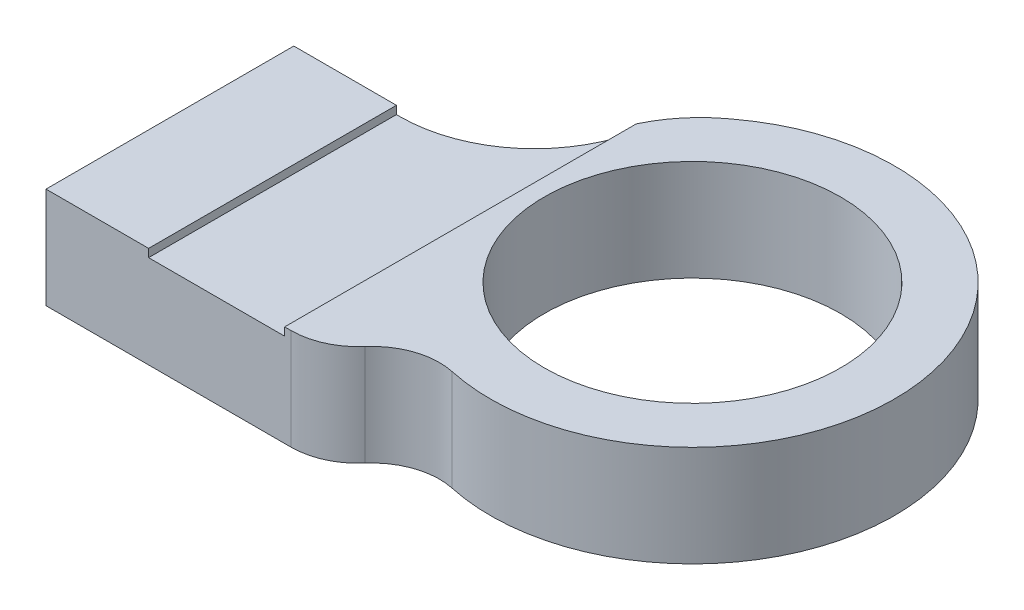
from build123d import *
from build123d.topology import SkipClean

# Parameters (mm, degrees)
BOSS_EXTRUDE1_DEPTH = 2.5
SKETCH2_W           = 10
SKETCH2_H           = 20
CUT_EXTRUDE1_DEPTH  = 0.6
SKETCH4_R           = 11
CUT_EXTRUDE2_DEPTH  = 34.634060118
BOSS_EXTRUDE2_START = 5
SKETCH6_R           = 15
BOSS_EXTRUDE2_DEPTH = 5
SKETCH7_R           = 11
CUT_EXTRUDE3_DEPTH  = 34.911649916
SKETCH8_W           = 18.819660113
SKETCH8_H           = 20
BOSS_EXTRUDE3_DEPTH = 5
FILLET1_R           = 10
BOSS_EXTRUDE4_DEPTH = 8
SKETCH11_W          = 16.12
SKETCH11_H          = 10
CUT_EXTRUDE6_DEPTH  = 10
FILLET2_R           = 10
FILLET3_R           = 10
FILLET4_R           = 5
FILLET5_R           = 5
SKETCH12_W          = 1.6
SKETCH12_H          = 32.071627579
CUT_EXTRUDE7_DEPTH  = 0.6
SKETCH13_W          = 1.5
SKETCH13_H          = 20
BOSS_EXTRUDE5_DEPTH = 0.6
SKETCH14_W          = 17.743382102
SKETCH14_H          = 16.653616468
CUT_EXTRUDE8_DEPTH  = 36.780581326
FILLET6_R           = 10
FILLET7_R           = 10


with BuildPart() as part:
    # Sketch1 → Boss-Extrude1 (new body)
    with BuildSketch(Plane(origin=(0, 0, 0), x_dir=(1, 0, 0), z_dir=(0, 1, 0))):
        with BuildLine():
            Line((-30, -10), (-11.180339887, -10))
            ThreePointArc((-11.180339887, -10), (15, 0), (-11.180339887, 10))
            Line((-11.180339887, 10), (-30, 10))
            Line((-30, 10), (-30, -10))
        make_face()
    extrude(amount=BOSS_EXTRUDE1_DEPTH)

    # Sketch2 → Cut-Extrude1 (cut)
    with BuildSketch(Plane(origin=(0, 2.5, 0), x_dir=(1, 0, 0), z_dir=(0, 1, 0))):
        with Locations((-18.880339887, 0)):
            Rectangle(SKETCH2_W, SKETCH2_H)
    extrude(amount=-CUT_EXTRUDE1_DEPTH, mode=Mode.SUBTRACT)

    # Sketch4 → Cut-Extrude2 (cut, through all)
    with BuildSketch(Plane(origin=(0, 2.5, 0), x_dir=(1, 0, 0), z_dir=(0, 1, 0))):
        with Locations(Location((0, 0, 0), (0, 0, 270))):
            Circle(SKETCH4_R)
    extrude(amount=-CUT_EXTRUDE2_DEPTH, mode=Mode.SUBTRACT)

    # Sketch6 → Boss-Extrude2 (add)
    with SkipClean():  # the faces are left unmerged after this step: merging them gives an invalid solid
        with BuildSketch(Plane.XZ.offset(BOSS_EXTRUDE2_START)):
            with Locations(Location((0, 0, 0), (0, 0, 270))):
                Circle(SKETCH6_R)
        extrude(amount=-BOSS_EXTRUDE2_DEPTH)

    # Sketch7 → Cut-Extrude3 (cut, through all)
    with SkipClean():  # the faces are left unmerged after this step: merging them gives an invalid solid
        with BuildSketch(Plane(origin=(0, 0, 0), x_dir=(1, 0, 0), z_dir=(0, 1, 0))):
            with Locations(Location((0, 0, 0), (0, 0, 270))):
                Circle(SKETCH7_R)
        extrude(amount=-CUT_EXTRUDE3_DEPTH, mode=Mode.SUBTRACT)

    # Sketch8 → Boss-Extrude3 (add)
    with SkipClean():  # the faces are left unmerged after this step: merging them gives an invalid solid
        with BuildSketch(Plane.XZ):
            with Locations((-20.590169944, 0)):
                Rectangle(SKETCH8_W, SKETCH8_H)
        extrude(amount=BOSS_EXTRUDE3_DEPTH)

    # Fillet1
    # the kernel refuses this fillet: 10 mm, written as the material it adds along each edge
    with BuildSketch(Plane(origin=(-11.180339887, 0, -10), x_dir=(-1, 0, 0), z_dir=(0, -1, 0))) as fillet1_piece_1:
        with BuildLine():
            CenterArc((3.819660113, 10), FILLET1_R, 233.130102354, 36.869897646)
            ThreePointArc((-2.180339887, 2), (-1.040737849, 1.053889384), (0, 0))
            Line((0, 0), (3.819660113, 0))
        make_face()
    extrude(amount=5)
    with BuildSketch(Plane(origin=(-11.180339887, 0, 10), x_dir=(0.7369259589108584, 0, 0.6759734692155542), z_dir=(0, -1, 0))) as fillet1_piece_2:
        with BuildLine():
            CenterArc((3.944928001, 9.951248487), FILLET1_R, 227.470208625, 36.869897646)
            Line((-2.814806691, 2.581988897), (0, 0))
            ThreePointArc((0, 0), (1.479348, 0.07312727), (2.958696001, 0))
        make_face()
    extrude(amount=5)
    with BuildSketch(Plane(origin=(-11.180339887, 0, 10), x_dir=(0.7369259589108588, 0, 0.6759734692155539), z_dir=(0, 1, 0))) as fillet1_piece_3_section:
        with BuildLine():
            CenterArc((3.944928001, -9.951248487), FILLET1_R, 95.659893729, 36.869897646)
            Line((-2.814806691, -2.581988897), (0, 0))
            ThreePointArc((0, 0), (1.479348, -0.07312727), (2.958696001, 0))
        make_face()
    fillet1_piece_3 = extrude(amount=2.5, mode=Mode.PRIVATE)
    fillet1_piece_3 = split(fillet1_piece_3, bisect_by=Plane(origin=(-11.180339887, 1.9, 10), z_dir=(0, -1, 0)), keep=Keep.TOP, mode=Mode.PRIVATE)
    fillet1_piece_3 = split(fillet1_piece_3, bisect_by=Plane(origin=(-13.880339887, 0, 10), z_dir=(1, 0, 0)), keep=Keep.TOP, mode=Mode.PRIVATE)
    add(fillet1_piece_3)
    with BuildSketch(Plane(origin=(-11.180339887, 0, 10), x_dir=(0.7369259589108588, 0, 0.6759734692155539), z_dir=(0, 1, 0))) as fillet1_piece_4_section:
        with BuildLine():
            CenterArc((3.944928001, -9.951248487), FILLET1_R, 95.659893729, 36.869897646)
            Line((-2.814806691, -2.581988897), (0, 0))
            ThreePointArc((0, 0), (1.479348, -0.07312727), (2.958696001, 0))
        make_face()
    fillet1_piece_4 = extrude(amount=2.5, mode=Mode.PRIVATE)
    fillet1_piece_4 = split(fillet1_piece_4, bisect_by=Plane(origin=(-11.180339887, 1.9, 10), z_dir=(0, -1, 0)), keep=Keep.TOP, mode=Mode.PRIVATE)
    fillet1_piece_4 = split(fillet1_piece_4, bisect_by=Plane(origin=(-13.880339887, 0, 10), z_dir=(-1, 0, 0)), keep=Keep.TOP, mode=Mode.PRIVATE)
    add(fillet1_piece_4)
    with BuildSketch(Plane(origin=(-11.180339887, 0, 10), x_dir=(0.7369259589108588, 0, 0.6759734692155539), z_dir=(0, 1, 0))) as fillet1_piece_5_section:
        with BuildLine():
            CenterArc((3.944928001, -9.951248487), FILLET1_R, 95.659893729, 36.869897646)
            Line((-2.814806691, -2.581988897), (0, 0))
            ThreePointArc((0, 0), (1.479348, -0.07312727), (2.958696001, 0))
        make_face()
    fillet1_piece_5 = extrude(amount=2.5, mode=Mode.PRIVATE)
    fillet1_piece_5 = split(fillet1_piece_5, bisect_by=Plane(origin=(-11.180339887, 1.9, 10), z_dir=(0, 1, 0)), keep=Keep.TOP, mode=Mode.PRIVATE)
    fillet1_piece_5 = split(fillet1_piece_5, bisect_by=Plane(origin=(-13.880339887, 0, 10), z_dir=(1, 0, 0)), keep=Keep.TOP, mode=Mode.PRIVATE)
    add(fillet1_piece_5)
    with BuildSketch(Plane(origin=(-11.180339887, 0, -10), x_dir=(-1, 0, 0), z_dir=(0, 1, 0))) as fillet1_piece_6_section:
        with BuildLine():
            CenterArc((3.819660113, -10), FILLET1_R, 90, 36.869897646)
            ThreePointArc((-2.180339887, -2), (-1.040737849, -1.053889384), (0, 0))
            Line((0, 0), (3.819660113, 0))
        make_face()
    fillet1_piece_6 = extrude(amount=2.5, mode=Mode.PRIVATE)
    fillet1_piece_6 = split(fillet1_piece_6, bisect_by=Plane(origin=(-11.180339887, 1.9, -10), z_dir=(0, -1, 0)), keep=Keep.TOP, mode=Mode.PRIVATE)
    fillet1_piece_6 = split(fillet1_piece_6, bisect_by=Plane(origin=(-13.880339887, 0, -10), z_dir=(-1, 0, 0)), keep=Keep.TOP, mode=Mode.PRIVATE)
    add(fillet1_piece_6)
    with BuildSketch(Plane(origin=(-11.180339887, 0, -10), x_dir=(-1, 0, 0), z_dir=(0, 1, 0))) as fillet1_piece_7_section:
        with BuildLine():
            CenterArc((3.819660113, -10), FILLET1_R, 90, 36.869897646)
            ThreePointArc((-2.180339887, -2), (-1.040737849, -1.053889384), (0, 0))
            Line((0, 0), (3.819660113, 0))
        make_face()
    fillet1_piece_7 = extrude(amount=2.5, mode=Mode.PRIVATE)
    fillet1_piece_7 = split(fillet1_piece_7, bisect_by=Plane(origin=(-11.180339887, 1.9, -10), z_dir=(0, -1, 0)), keep=Keep.TOP, mode=Mode.PRIVATE)
    fillet1_piece_7 = split(fillet1_piece_7, bisect_by=Plane(origin=(-13.880339887, 0, -10), z_dir=(1, 0, 0)), keep=Keep.TOP, mode=Mode.PRIVATE)
    add(fillet1_piece_7)
    with BuildSketch(Plane(origin=(-11.180339887, 0, -10), x_dir=(-1, 0, 0), z_dir=(0, 1, 0))) as fillet1_piece_8_section:
        with BuildLine():
            CenterArc((3.819660113, -10), FILLET1_R, 90, 36.869897646)
            ThreePointArc((-2.180339887, -2), (-1.040737849, -1.053889384), (0, 0))
            Line((0, 0), (3.819660113, 0))
        make_face()
    fillet1_piece_8 = extrude(amount=2.5, mode=Mode.PRIVATE)
    fillet1_piece_8 = split(fillet1_piece_8, bisect_by=Plane(origin=(-11.180339887, 1.9, -10), z_dir=(0, 1, 0)), keep=Keep.TOP, mode=Mode.PRIVATE)
    fillet1_piece_8 = split(fillet1_piece_8, bisect_by=Plane(origin=(-13.880339887, 0, -10), z_dir=(1, 0, 0)), keep=Keep.TOP, mode=Mode.PRIVATE)
    add(fillet1_piece_8)

    # Sketch10 → Boss-Extrude4 (add)
    with BuildSketch(Plane.XY.offset(10)):
        Polygon((-30, -5), (-30, 2.5), (-23.880339887, 2.5), (-23.880339887, 1.9), (-13.880339887, 1.9), (-13.880339887, 2.5), (-9, 2.5), (-9, -5), align=None)
    extrude(amount=BOSS_EXTRUDE4_DEPTH)

    # Sketch11 → Cut-Extrude6 (cut, symmetric)
    with BuildSketch(Plane(origin=(0, 0, 0), x_dir=(1, 0, 0), z_dir=(0, 1, 0))):
        with Locations((-21.94, 7)):
            Rectangle(SKETCH11_W, SKETCH11_H)
    extrude(amount=CUT_EXTRUDE6_DEPTH, both=True, mode=Mode.SUBTRACT)

    # Fillet2
    fillet2_edges = [part.edges().sort_by_distance(p)[0] for p in [
        (-13.88, -1.25, -10.062917933),
    ]]
    fillet(fillet2_edges, radius=FILLET2_R)

    # Fillet3
    # the kernel refuses this fillet: 10 mm, written as the material it adds along each edge
    with BuildSketch(Plane(origin=(-13.88, -5, -2), x_dir=(0.16934009011749904, 0, -0.9855576765867116), z_dir=(0, 1, 0))) as fillet3_piece_1_section:
        with BuildLine():
            CenterArc((8.493185498, 9.622504823), FILLET3_R, 189.749452729, 64.457385312)
            Line((-1.362391268, 7.929103922), (-2.347948945, 7.759763832))
            Line((-2.347948945, 7.759763832), (-0.985557677, -0.16934009))
            Line((-0.985557677, -0.16934009), (0.16934009, -0.985557677))
            ThreePointArc((0.16934009, -0.985557677), (1.525816528, -0.752485734), (5.499366011, -0.962250482))
            Line((5.499366011, -0.962250482), (5.771531419, 0))
        make_face()
    fillet3_piece_1 = extrude(amount=27.613241747, mode=Mode.PRIVATE)
    fillet3_piece_1 = split(fillet3_piece_1, bisect_by=Plane(origin=(-13.88, 1.9, -2), z_dir=(0, -1, 0)), keep=Keep.TOP, mode=Mode.PRIVATE)
    add(fillet3_piece_1)
    with BuildSketch(Plane(origin=(-13.88, -25.113241747, -2), x_dir=(0.16934009011749904, 0, -0.9855576765867116), z_dir=(0, 1, 0))) as fillet3_piece_2_section:
        with BuildLine():
            CenterArc((8.493185498, 9.622504823), FILLET3_R, 189.749452729, 64.457385312)
            Line((-1.362391268, 7.929103922), (-2.347948945, 7.759763832))
            Line((-2.347948945, 7.759763832), (-0.985557677, -0.16934009))
            Line((-0.985557677, -0.16934009), (0.16934009, -0.985557677))
            ThreePointArc((0.16934009, -0.985557677), (1.525816528, -0.752485734), (5.499366011, -0.962250482))
            Line((5.499366011, -0.962250482), (5.771531419, 0))
        make_face()
    fillet3_piece_2 = extrude(amount=27.613241747, mode=Mode.PRIVATE)
    fillet3_piece_2 = split(fillet3_piece_2, bisect_by=Plane(origin=(-13.880339887, -25.113241747, -2), z_dir=(1, 0, 0)), keep=Keep.TOP, mode=Mode.PRIVATE)
    fillet3_piece_2 = split(fillet3_piece_2, bisect_by=Plane(origin=(-13.88, 1.9, -2), z_dir=(0, 1, 0)), keep=Keep.TOP, mode=Mode.PRIVATE)
    add(fillet3_piece_2)

    # Fillet4
    # the kernel refuses this fillet: 5 mm, written as the material it adds along each edge
    with BuildSketch(Plane(origin=(-9, 0, 12), x_dir=(0, 0, 1), z_dir=(0, -1, 0))) as fillet4_piece_1:
        with BuildLine():
            CenterArc((7.544416527, -4.75549972), FILLET4_R, 107.991946178, 84.260829523)
            Line((2.658312395, -5.81662479), (2.560590313, -5.837847292))
            ThreePointArc((2.560590313, -5.837847292), (1.551800458, -2.806559571), (-0.08, -0.06))
            Line((-0.08, -0.06), (0, 0.1))
            ThreePointArc((0, 0.1), (3, 0.1), (5.969111669, 0.095109994))
            Line((5.969111669, 0.095109994), (6, 0))
        make_face()
    extrude(amount=5)
    with BuildSketch(Plane(origin=(-9, 0, 12), x_dir=(0, 0, 1), z_dir=(0, 1, 0))) as fillet4_piece_2:
        with BuildLine():
            CenterArc((7.544416527, 4.75549972), FILLET4_R, 167.7472243, 84.260829523)
            Line((2.658312395, 5.81662479), (2.560590313, 5.837847292))
            ThreePointArc((2.560590313, 5.837847292), (1.551800458, 2.806559571), (-0.08, 0.06))
            Line((-0.08, 0.06), (0, -0.1))
            ThreePointArc((0, -0.1), (3, -0.1), (5.969111669, -0.095109994))
            Line((5.969111669, -0.095109994), (6, 0))
        make_face()
    extrude(amount=2.5)

    # Fillet5
    # the kernel refuses this fillet: 5 mm, written as the material it takes off along each edge
    with BuildSketch(Plane(origin=(-9, 9.514063374, 18), x_dir=(0.49143032961767363, 0, -0.8709168910589946), z_dir=(0, -1, 0))) as fillet5_piece_1:
        with BuildLine():
            CenterArc((2.975815065, -4.900618155), FILLET5_R, 101.442690238, 49.122673346)
            Line((-1.37876939, -2.443466507), (0, 0))
            ThreePointArc((0, 0), (0.991938355, -0.099381845), (1.98387671, 0))
        make_face()
    extrude(amount=21.528126747, mode=Mode.SUBTRACT)

    # Sketch12 → Cut-Extrude7 (cut)
    with BuildSketch(Plane(origin=(0, 2.5, 0), x_dir=(1, 0, 0), z_dir=(0, 1, 0))):
        with Locations((-13.080339887, -1.96418621)):
            Rectangle(SKETCH12_W, SKETCH12_H)
    extrude(amount=-CUT_EXTRUDE7_DEPTH, mode=Mode.SUBTRACT)

    # Sketch13 → Boss-Extrude5 (add)
    with BuildSketch(Plane(origin=(0, 1.9, 0), x_dir=(1, 0, 0), z_dir=(0, 1, 0))):
        with Locations((-23.130339887, -8)):
            Rectangle(SKETCH13_W, SKETCH13_H)
    extrude(amount=BOSS_EXTRUDE5_DEPTH)

    # Sketch14 → Cut-Extrude8 (cut, through all)
    with BuildSketch(Plane(origin=(0, 2.5, 0), x_dir=(1, 0, 0), z_dir=(0, 1, 0))):
        with Locations((-21.128308949, 8.726808234)):
            Rectangle(SKETCH14_W, SKETCH14_H)
    extrude(amount=-CUT_EXTRUDE8_DEPTH, mode=Mode.SUBTRACT)

    # Fillet6
    # the kernel refuses this fillet: 10 mm, written as the material it adds along each edge
    with BuildSketch(Plane(origin=(-12.256617898, 2.5, -0.4), x_dir=(0, 0, -1), z_dir=(0, -1, 0))) as fillet6_piece_1_section:
        with BuildLine():
            CenterArc((10, -9.877293528), FILLET6_R, 98.984966406, 81.015033594)
            Line((0, -9.877293528), (0, 0))
            Line((0, 0), (8.438246956, 0))
        make_face()
    fillet6_piece_1 = extrude(amount=7.5, mode=Mode.PRIVATE)
    fillet6_piece_1 = split(fillet6_piece_1, bisect_by=Plane(origin=(-12.280339887, 2.5, -0.4), z_dir=(1, 0, 0)), keep=Keep.TOP, mode=Mode.PRIVATE)
    add(fillet6_piece_1)
    with BuildSketch(Plane(origin=(-12.256617898, 27.193233819, -0.4), x_dir=(0, 0, -1), z_dir=(0, -1, 0))) as fillet6_piece_2_section:
        with BuildLine():
            CenterArc((10, -9.877293528), FILLET6_R, 98.984966406, 81.015033594)
            Line((0, -9.877293528), (0, 0))
            Line((0, 0), (8.438246956, 0))
        make_face()
    fillet6_piece_2 = extrude(amount=32.193233819, mode=Mode.PRIVATE)
    fillet6_piece_2 = split(fillet6_piece_2, bisect_by=Plane(origin=(-12.256617898, 1.9, -0.4), z_dir=(0, -1, 0)), keep=Keep.TOP, mode=Mode.PRIVATE)
    add(fillet6_piece_2)

    # Fillet7
    # the kernel refuses this fillet: 10 mm, written as the material it takes off along each edge
    with BuildSketch(Plane(origin=(-12.256617898, 13.465001661, -8.838246956), x_dir=(-0.24364329943227025, -7.330652331656778e-15, 0.9698649094805714), z_dir=(0, -1, 0))) as fillet7_piece_1:
        with BuildLine():
            CenterArc((2.675540731, -9.960151058), FILLET7_R, 95.11670471, 34.796493554)
            Line((-3.740722604, -2.289977342), (-4.382348937, -1.522959971))
            ThreePointArc((-4.382348937, -1.522959971), (-4.120966176, -1.295615595), (-0.325639131, 0.945494133))
            Line((-0.325639131, 0.945494133), (0.089184691, 0.996015106))
            ThreePointArc((0.089184691, 0.996015106), (0.89184691, 0.960151058), (1.69450913, 0.996015106))
            Line((1.69450913, 0.996015106), (1.783693821, 0))
        make_face()
    extrude(amount=29.430003321, mode=Mode.SUBTRACT)


solid = part.part
